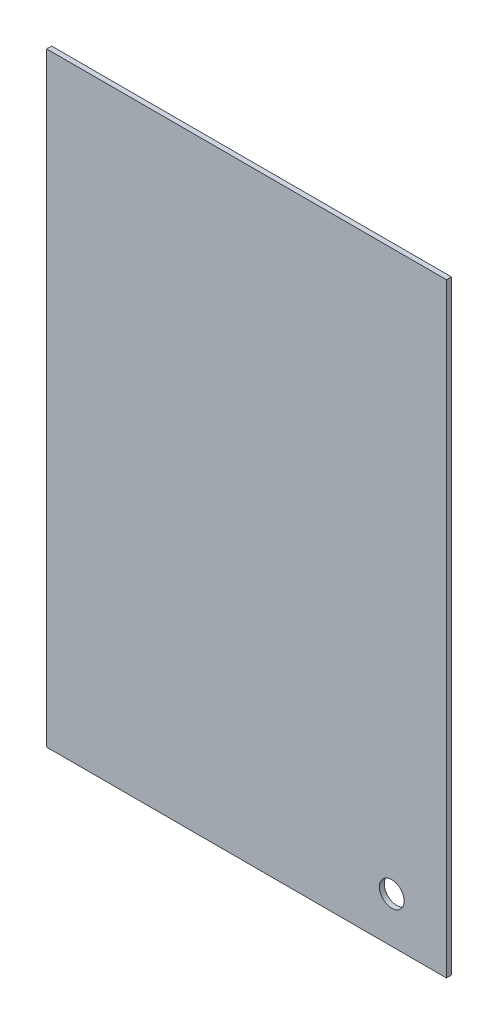
from build123d import *

# Parameters (mm, degrees)
SKETCH1_W           = 242
SKETCH1_H           = 366
BOSS_EXTRUDE1_DEPTH = 3
CUT_EXTRUDE1_REACH  = 221.406
SKETCH2_R           = 7.5


with BuildPart() as part:
    # Sketch1 → Boss-Extrude1 (new body)
    with BuildSketch(Plane.XY):
        Rectangle(SKETCH1_W, SKETCH1_H)
    extrude(amount=BOSS_EXTRUDE1_DEPTH)

    # Sketch2 → Cut-Extrude1 (cut, up to next)
    with BuildSketch(Plane.XY.offset(3), mode=Mode.PRIVATE) as cut_extrude1_sk1:
        with Locations((87.9, -155.5)):
            Circle(SKETCH2_R)
    cut_extrude1_tool1 = extrude(cut_extrude1_sk1.sketch, amount=-CUT_EXTRUDE1_REACH, mode=Mode.PRIVATE) & part.part
    add(cut_extrude1_tool1.solids().sort_by_distance((87.9, -155.5, 3))[0], mode=Mode.SUBTRACT)


solid = part.part
